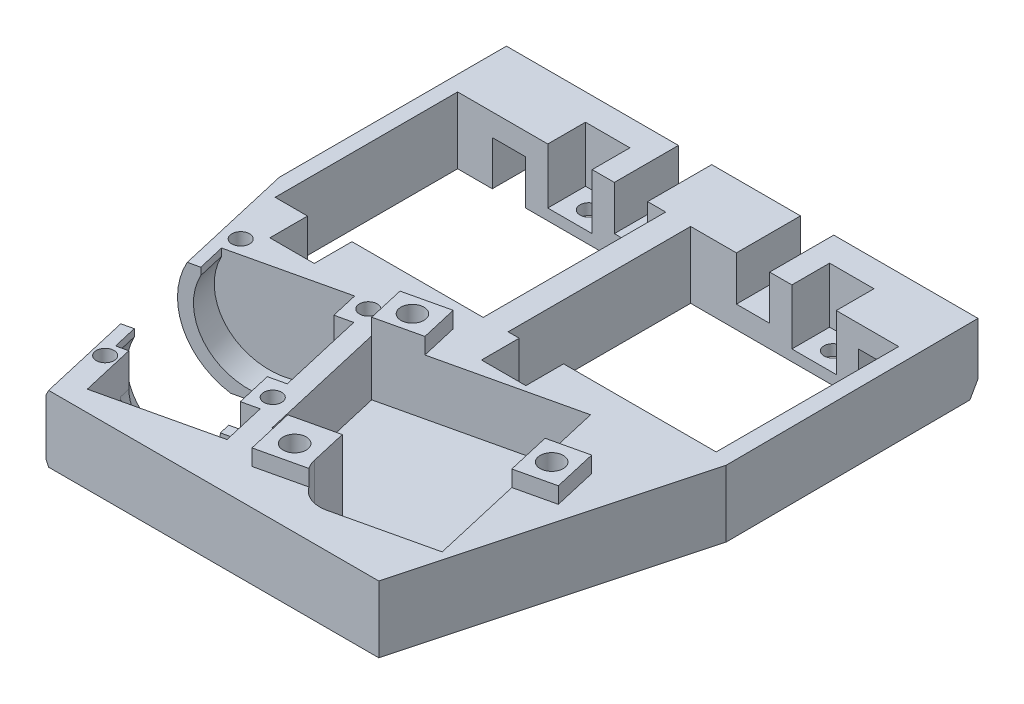
from build123d import *

# Parameters (mm, degrees)
BOSS_EXTRUDE2_DEPTH      = 6
BOSS_EXTRUDE2_DEPTH_BACK = 6
CUT_EXTRUDE1_DEPTH       = 121.097055122
CUT_EXTRUDE1_DEPTH_BACK  = 121.097055122
SKETCH2_W                = 35.5
SKETCH2_H                = 32.9
CUT_EXTRUDE2_START       = 6
SKETCH2_9_W              = 8
SKETCH2_9_H              = 6.8
SKETCH2_9_R              = 1.6
CUT_EXTRUDE2_DEPTH       = 10
CUT_EXTRUDE15_DEPTH      = 121.097055122
CUT_EXTRUDE15_DEPTH_BACK = 117.097055122
CUT_EXTRUDE15_START      = -4
SKETCH2_11_W             = 8
SKETCH2_11_H             = 6.8
SKETCH2_11_R             = 1.6
EXTRUDE_THIN1_START      = -6
EXTRUDE_THIN1_DEPTH      = 4.7
BOSS_EXTRUDE7_START      = -10.7
SKETCH2_15_W             = 8
SKETCH2_15_H             = 6.8
BOSS_EXTRUDE7_DEPTH      = 2
CUT_EXTRUDE3_DEPTH       = 121.423389128
CUT_EXTRUDE3_DEPTH_BACK  = 121.423389128
SKETCH2_10_R             = 1.6
CUT_EXTRUDE4_DEPTH       = 121.423389128
CUT_EXTRUDE4_DEPTH_BACK  = 121.423389128
SKETCH4_W                = 37.5
SKETCH4_H                = 32.9
CUT_EXTRUDE5_START       = -6
SKETCH5_W                = 6
SKETCH5_H                = 11.55
CUT_EXTRUDE5_DEPTH       = 8
CUT_EXTRUDE6_START       = 6
SKETCH5_4_W              = 6
SKETCH5_4_H              = 11.55
CUT_EXTRUDE6_DEPTH       = 8
CUT_EXTRUDE7_DEPTH       = 121.423389128
CUT_EXTRUDE7_DEPTH_BACK  = 121.423389128
BOSS_EXTRUDE3_START      = 8
BOSS_EXTRUDE3_DEPTH      = 5
BOSS_EXTRUDE4_START      = -13
BOSS_EXTRUDE4_DEPTH      = 5
CUT_EXTRUDE9_START       = 8
SKETCH12_4_R             = 13
CUT_EXTRUDE9_DEPTH       = 5
CUT_EXTRUDE10_START      = -12.5
SKETCH12_5_R             = 13
CUT_EXTRUDE10_DEPTH      = 4.5
BOSS_EXTRUDE5_START      = 8
BOSS_EXTRUDE5_DEPTH      = 5
BOSS_EXTRUDE6_START      = -12.5
BOSS_EXTRUDE6_DEPTH      = 4.5
BOSS_EXTRUDE9_START      = 13
BOSS_EXTRUDE9_DEPTH      = 3
BOSS_EXTRUDE10_START     = -17.5
BOSS_EXTRUDE10_DEPTH     = 5
CUT_EXTRUDE20_DEPTH      = 89.442017134
CUT_EXTRUDE20_DEPTH_BACK = 89.442017134
CUT_EXTRUDE11_START      = -4
CUT_EXTRUDE11_DEPTH      = 10
BOSS_EXTRUDE8_START      = 6
SKETCH14_5_W             = 6.8
SKETCH14_5_H             = 8
SKETCH14_5_W_2           = 8.6
SKETCH14_5_H_2           = 8.2
SKETCH14_5_W_3           = 8
SKETCH14_5_H_3           = 7
BOSS_EXTRUDE8_DEPTH      = 2.9
CUT_EXTRUDE13_DEPTH      = 121.54585289
CUT_EXTRUDE13_DEPTH_BACK = 121.54585289
SKETCH14_4_R             = 2.075
FILLET1_R                = 5
CUT_EXTRUDE16_START      = -22.5
SKETCH17_R               = 7.5
SKETCH17_R_2             = 5.5
CUT_EXTRUDE16_DEPTH      = 10
CUT_EXTRUDE17_DEPTH      = 6
CUT_EXTRUDE18_DEPTH      = 121.54585289
CUT_EXTRUDE19_START      = 1.452584
SKETCH18_4_W             = 25.5
SKETCH18_4_H             = 20
CUT_EXTRUDE19_DEPTH      = 4.547416
CUT_EXTRUDE21_START      = 6
SKETCH21_R               = 1.6
CUT_EXTRUDE21_DEPTH      = 10
CUT_EXTRUDE22_DEPTH      = 121.54585289
CUT_EXTRUDE22_DEPTH_BACK = 121.54585289


# Read off the part's stored shape, not the designer's step: Boss-Extrude3, Boss-Extrude4, Boss-Extrude10, Cut-Extrude17
with BuildPart() as part:
    # Sketch1 → Boss-Extrude2 (new, two sides: drawn at the far end of the back side and taken through both)
    with BuildSketch(Plane(origin=(0, 0, 0), x_dir=(1, 0, 0), z_dir=(0, 1, 0)).offset(-BOSS_EXTRUDE2_DEPTH_BACK)):
        Polygon((-12, 0), (73, 0), (73.227745076, -45.633383306), (60, -95), (0, -95), (-12, -43.022289509), align=None)
    extrude(amount=BOSS_EXTRUDE2_DEPTH + BOSS_EXTRUDE2_DEPTH_BACK)

    # Sketch2 → Cut-Extrude1 (cut, two sides: drawn at the far end of the back side and taken through both)
    with BuildSketch(Plane(origin=(0, 0, 0), x_dir=(1, 0, 0), z_dir=(0, 1, 0)).offset(-CUT_EXTRUDE1_DEPTH_BACK)):
        with Locations((8.5, -28)):
            Rectangle(SKETCH2_W, SKETCH2_H)
        with Locations((52.5, -28)):
            Rectangle(SKETCH2_W, SKETCH2_H)
    extrude(amount=CUT_EXTRUDE1_DEPTH + CUT_EXTRUDE1_DEPTH_BACK, mode=Mode.SUBTRACT)

    # Sketch2<9> → Cut-Extrude2 (cut)
    with BuildSketch(Plane(origin=(0, 0, 0), x_dir=(1, 0, 0), z_dir=(0, 1, 0)).offset(CUT_EXTRUDE2_START)):
        with Locations((11, -8.15)):
            Rectangle(SKETCH2_9_W, SKETCH2_9_H)
        with Locations((0.6, -47.85)):
            Rectangle(SKETCH2_9_W, SKETCH2_9_H)
        with Locations((55, -8.15)):
            Rectangle(SKETCH2_9_W, SKETCH2_9_H)
        with Locations(Location((38.75, -47.85, 0), (0, 0, 90))):
            Circle(SKETCH2_9_R)
    extrude(amount=-CUT_EXTRUDE2_DEPTH, mode=Mode.SUBTRACT)

    # Sketch2<11> → Cut-Extrude15 (cut, two sides: drawn at the far end of the back side and taken through both)
    # profile 1 of 2: a face of its own
    with BuildSketch(Plane(origin=(0, 0, 0), x_dir=(1, 0, 0), z_dir=(0, 1, 0)).offset(CUT_EXTRUDE15_START - CUT_EXTRUDE15_DEPTH_BACK)):
        with Locations((38.75, -47.85)):
            Rectangle(SKETCH2_11_W, SKETCH2_11_H)
        with Locations((38.75, -47.85)):
            Circle(SKETCH2_11_R, mode=Mode.SUBTRACT)
    # profile 2 of 2: a face of its own
    with BuildSketch(Plane(origin=(0, 0, 0), x_dir=(1, 0, 0), z_dir=(0, 1, 0)).offset(CUT_EXTRUDE15_START - CUT_EXTRUDE15_DEPTH_BACK)):
        with Locations((38.75, -47.85)):
            Circle(SKETCH2_11_R)
    extrude(amount=CUT_EXTRUDE15_DEPTH + CUT_EXTRUDE15_DEPTH_BACK, mode=Mode.SUBTRACT)

    # Sketch16 → Extrude-Thin1 (add)
    with BuildSketch(Plane(origin=(0, 0, 0), x_dir=(1, 0, 0), z_dir=(0, 1, 0)).offset(EXTRUDE_THIN1_START)):
        Polygon((34.75, -44.45), (34.75, -51.25), (42.75, -51.25), (42.75, -44.45), (44.75, -44.45), (44.75, -53.25), (32.75, -53.25), (32.75, -44.45), align=None)
    extrude(amount=-EXTRUDE_THIN1_DEPTH)

    # Sketch2<15> → Boss-Extrude7 (add)
    with BuildSketch(Plane(origin=(0, 0, 0), x_dir=(1, 0, 0), z_dir=(0, 1, 0)).offset(BOSS_EXTRUDE7_START)):
        with Locations((38.75, -47.85)):
            Rectangle(SKETCH2_15_W, SKETCH2_15_H)
    extrude(amount=BOSS_EXTRUDE7_DEPTH)

    # Sketch2<10> → Cut-Extrude3 (cut, two sides: drawn at the far end of the back side and taken through both)
    with BuildSketch(Plane(origin=(0, 0, 0), x_dir=(1, 0, 0), z_dir=(0, 1, 0)).offset(-CUT_EXTRUDE3_DEPTH_BACK)):
        with Locations(Location((0.6, -47.85, 0), (0, 0, 270))):
            Circle(SKETCH2_10_R)
        with Locations(Location((38.75, -47.85, 0), (0, 0, 270))):
            Circle(SKETCH2_10_R)
        with Locations(Location((55, -8.15, 0), (0, 0, 90))):
            Circle(SKETCH2_10_R)
        with Locations(Location((11, -8.15, 0), (0, 0, 90))):
            Circle(SKETCH2_10_R)
    extrude(amount=CUT_EXTRUDE3_DEPTH + CUT_EXTRUDE3_DEPTH_BACK, mode=Mode.SUBTRACT)

    # Sketch4 → Cut-Extrude4 (cut, two sides: drawn at the far end of the back side and taken through both)
    with BuildSketch(Plane(origin=(0, 0, 0), x_dir=(1, 0, 0), z_dir=(0, 1, 0)).offset(-CUT_EXTRUDE4_DEPTH_BACK)):
        with Locations((9.5, -28)):
            Rectangle(SKETCH4_W, SKETCH4_H)
        with Locations((51.5, -28)):
            Rectangle(SKETCH4_W, SKETCH4_H)
    extrude(amount=CUT_EXTRUDE4_DEPTH + CUT_EXTRUDE4_DEPTH_BACK, mode=Mode.SUBTRACT)

    # Sketch5 → Cut-Extrude5 (cut)
    with BuildSketch(Plane(origin=(0, 0, 0), x_dir=(1, 0, 0), z_dir=(0, 1, 0)).offset(CUT_EXTRUDE5_START)):
        with Locations((0, -5.775)):
            Rectangle(SKETCH5_W, SKETCH5_H)
        with Locations((66, -5.775)):
            Rectangle(SKETCH5_W, SKETCH5_H)
    extrude(amount=CUT_EXTRUDE5_DEPTH, mode=Mode.SUBTRACT)

    # Sketch5<4> → Cut-Extrude6 (cut)
    with BuildSketch(Plane(origin=(0, 0, 0), x_dir=(1, 0, 0), z_dir=(0, 1, 0)).offset(CUT_EXTRUDE6_START)):
        with Locations((22, -5.775)):
            Rectangle(SKETCH5_4_W, SKETCH5_4_H)
        with Locations((44, -5.775)):
            Rectangle(SKETCH5_4_W, SKETCH5_4_H)
    extrude(amount=-CUT_EXTRUDE6_DEPTH, mode=Mode.SUBTRACT)

    # Sketch11 → Cut-Extrude7 (cut, two sides: drawn at the far end of the back side and taken through both)
    with BuildSketch(Plane(origin=(0, 0, 0), x_dir=(0.2249510543438689, 0, 0.9743700647852344), z_dir=(0, 1, 0)).offset(-CUT_EXTRUDE7_DEPTH_BACK)):
        Polygon((59.335574448, -9.370350163), (59.335574448, 4.129649837), (75.335574448, 4.129649837), (75.335574448, -9.370350163), (75.335574448, -28.058089367), (59.335574448, -28.058089367), align=None)
    extrude(amount=CUT_EXTRUDE7_DEPTH + CUT_EXTRUDE7_DEPTH_BACK, mode=Mode.SUBTRACT)

    # Boss-Extrude3 outline → Boss-Extrude3 (add)
    with BuildSketch(Plane(origin=(15.147208467, 0, 65.609768037), x_dir=(0.9743700647852345, 0, -0.2249510543438689), z_dir=(-0.2249510543438689, 0, -0.9743700647852345)).offset(BOSS_EXTRUDE3_START)):
        with BuildLine():
            Line((-20.902912757, 6), (-18.108771073, 6))
            ThreePointArc((-18.108771073, 6), (-9.370350163, 10.6), (-0.631929253, 6))
            Line((-0.631929253, 6), (2.162212432, 6))
            ThreePointArc((2.162212432, 6), (-0.576522413, 9.574371703), (-4.370350163, 12))
            Line((-4.370350163, 12), (-14.370350163, 12))
            ThreePointArc((-14.370350163, 12), (-18.164177912, 9.574371703), (-20.902912757, 6))
        make_face()
    extrude(amount=BOSS_EXTRUDE3_DEPTH)

    # Boss-Extrude4 outline → Boss-Extrude4 (add)
    with BuildSketch(Plane(origin=(15.147208467, 0, 65.609768037), x_dir=(0.9743700647852345, 0, -0.2249510543438689), z_dir=(-0.2249510543438689, 0, -0.9743700647852345)).offset(BOSS_EXTRUDE4_START)):
        with BuildLine():
            ThreePointArc((-18.108771073, 6), (-9.370350163, 10.6), (-0.631929253, 6))
            Line((-0.631929253, 6), (2.162212432, 6))
            ThreePointArc((2.162212432, 6), (-0.576522413, 9.574371703), (-4.370350163, 12))
            Line((-4.370350163, 12), (-14.370350163, 12))
            ThreePointArc((-14.370350163, 12), (-18.164177912, 9.574371703), (-20.902912757, 6))
            Line((-20.902912757, 6), (-18.108771073, 6))
        make_face()
    extrude(amount=BOSS_EXTRUDE4_DEPTH)

    # Sketch12<4> → Cut-Extrude9 (cut)
    with BuildSketch(Plane(origin=(15.147208467, 0, 65.609768037), x_dir=(0.9743700647852345, 0, -0.2249510543438689), z_dir=(-0.2249510543438689, 0, -0.9743700647852345)).offset(CUT_EXTRUDE9_START)):
        with Locations((-9.370350163, 0)):
            Circle(SKETCH12_4_R)
    extrude(amount=CUT_EXTRUDE9_DEPTH, mode=Mode.SUBTRACT)

    # Sketch12<5> → Cut-Extrude10 (cut)
    with BuildSketch(Plane(origin=(15.147208467, 0, 65.609768037), x_dir=(0.9743700647852345, 0, -0.2249510543438689), z_dir=(-0.2249510543438689, 0, -0.9743700647852345)).offset(CUT_EXTRUDE10_START)):
        with Locations((-9.370350163, 0)):
            Circle(SKETCH12_5_R)
    extrude(amount=CUT_EXTRUDE10_DEPTH, mode=Mode.SUBTRACT)

    # Sketch12<7> → Boss-Extrude5 (add)
    with BuildSketch(Plane(origin=(15.147208467, 0, 65.609768037), x_dir=(0.9743700647852345, 0, -0.2249510543438689), z_dir=(-0.2249510543438689, 0, -0.9743700647852345)).offset(BOSS_EXTRUDE5_START)):
        with BuildLine():
            Line((-21.370350163, 5), (-21.370350163, 3.163053095))
            Line((-21.370350163, 3.163053095), (-21.370350163, -4.002520569))
            Line((-21.370350163, -4.002520569), (-21.370350163, -5))
            ThreePointArc((-21.370350163, -5), (-21.147250246, -5.504963618), (-20.902912757, -6))
            Line((-20.902912757, -6), (-18.108771073, -6))
            ThreePointArc((-18.108771073, -6), (-19.970350163, 0), (-18.108771073, 6))
            ThreePointArc((-18.108771073, 6), (-9.370350163, 10.6), (-0.631929253, 6))
            ThreePointArc((-0.631929253, 6), (0.753563647, 3.141077709), (1.229649837, 0))
            ThreePointArc((1.229649837, 0), (0.753563647, -3.141077709), (-0.631929253, -6))
            Line((-0.631929253, -6), (2.162212432, -6))
            ThreePointArc((2.162212432, -6), (3.257462667, -3.088420816), (3.629649837, 0))
            ThreePointArc((3.629649837, 0), (1.446303664, 7.211102551), (-4.370350163, 12))
            Line((-4.370350163, 12), (-14.370350163, 12))
            ThreePointArc((-14.370350163, 12), (-18.562738318, 9.192388155), (-21.370350163, 5))
        make_face()
        with BuildLine():
            Line((-21.370350163, -4.002520569), (-21.370350163, 3.163053095))
            Line((-21.370350163, 3.163053095), (-21.370350163, 5))
            ThreePointArc((-21.370350163, 5), (-22.370350163, 0), (-21.370350163, -5))
            Line((-21.370350163, -5), (-21.370350163, -4.002520569))
        make_face()
    extrude(amount=BOSS_EXTRUDE5_DEPTH)

    # Sketch12<9> → Boss-Extrude6 (add)
    with BuildSketch(Plane(origin=(15.147208467, 0, 65.609768037), x_dir=(0.9743700647852345, 0, -0.2249510543438689), z_dir=(-0.2249510543438689, 0, -0.9743700647852345)).offset(BOSS_EXTRUDE6_START)):
        with BuildLine():
            ThreePointArc((-14.370350163, 12), (-21.590473177, 4.434928806), (-20.902912757, -6))
            Line((-20.902912757, -6), (-18.108771073, -6))
            ThreePointArc((-18.108771073, -6), (-9.370350163, 10.6), (-0.631929253, -6))
            Line((-0.631929253, -6), (2.162212432, -6))
            ThreePointArc((2.162212432, -6), (2.849772852, 4.434928806), (-4.370350163, 12))
            Line((-4.370350163, 12), (-14.370350163, 12))
        make_face()
    extrude(amount=BOSS_EXTRUDE6_DEPTH)

    # Sketch12<10> → Boss-Extrude9 (add)
    with BuildSketch(Plane(origin=(15.147208467, 0, 65.609768037), x_dir=(0.9743700647852345, 0, -0.2249510543438689), z_dir=(-0.2249510543438689, 0, -0.9743700647852345)).offset(BOSS_EXTRUDE9_START)):
        with BuildLine():
            Line((-21.370350163, 5), (-21.370350163, 3.163053095))
            Line((-21.370350163, 3.163053095), (-21.370350163, -4.002520569))
            Line((-21.370350163, -4.002520569), (-21.370350163, -5))
            ThreePointArc((-21.370350163, -5), (-21.147250246, -5.504963618), (-20.902912757, -6))
            Line((-20.902912757, -6), (-18.108771073, -6))
            ThreePointArc((-18.108771073, -6), (-19.970350163, 0), (-18.108771073, 6))
            ThreePointArc((-18.108771073, 6), (-9.370350163, 10.6), (-0.631929253, 6))
            ThreePointArc((-0.631929253, 6), (0.753563647, 3.141077709), (1.229649837, 0))
            ThreePointArc((1.229649837, 0), (0.753563647, -3.141077709), (-0.631929253, -6))
            Line((-0.631929253, -6), (2.162212432, -6))
            ThreePointArc((2.162212432, -6), (3.257462667, -3.088420816), (3.629649837, 0))
            ThreePointArc((3.629649837, 0), (1.446303664, 7.211102551), (-4.370350163, 12))
            Line((-4.370350163, 12), (-14.370350163, 12))
            ThreePointArc((-14.370350163, 12), (-18.562738318, 9.192388155), (-21.370350163, 5))
        make_face()
        with BuildLine():
            ThreePointArc((-0.631929253, 6), (-9.370350163, 10.6), (-18.108771073, 6))
            Line((-18.108771073, 6), (-0.631929253, 6))
        make_face()
    extrude(amount=BOSS_EXTRUDE9_DEPTH)

    # Boss-Extrude10 outline → Boss-Extrude10 (add)
    with BuildSketch(Plane(origin=(15.147208467, 0, 65.609768037), x_dir=(0.9743700647852345, 0, -0.2249510543438689), z_dir=(-0.2249510543438689, 0, -0.9743700647852345)).offset(BOSS_EXTRUDE10_START)):
        with BuildLine():
            Line((-4.370350163, 12), (-14.370350163, 12))
            ThreePointArc((-14.370350163, 12), (-18.164177912, 9.574371703), (-20.902912757, 6))
            Line((-20.902912757, 6), (2.162212432, 6))
            ThreePointArc((2.162212432, 6), (-0.576522413, 9.574371703), (-4.370350163, 12))
        make_face()
    extrude(amount=BOSS_EXTRUDE10_DEPTH)

    # Sketch20 → Cut-Extrude20 (cut, two sides: drawn at the far end of the back side and taken through both)
    with BuildSketch(Plane(origin=(15.147208467, 0, 65.609768037), x_dir=(0.9743700647852345, 0, -0.2249510543438689), z_dir=(-0.2249510543438689, 0, -0.9743700647852345)).offset(-CUT_EXTRUDE20_DEPTH_BACK)):
        with BuildLine():
            ThreePointArc((-20.902912757, -6), (-22.370350163, 0), (-20.902912757, 6))
            Line((-20.902912757, 6), (-20.902912757, 13.688121188))
            Line((-20.902912757, 13.688121188), (-35.899233089, 13.688121188))
            Line((-35.899233089, 13.688121188), (-35.899233089, -13.876807322))
            Line((-35.899233089, -13.876807322), (-20.902912757, -13.876807322))
            Line((-20.902912757, -13.876807322), (-20.902912757, -6))
        make_face()
    extrude(amount=CUT_EXTRUDE20_DEPTH + CUT_EXTRUDE20_DEPTH_BACK, mode=Mode.SUBTRACT)

    # Sketch14 → Cut-Extrude11 (cut)
    with BuildSketch(Plane(origin=(0, 0, 0), x_dir=(0.2249510543438689, 0, 0.9743700647852344), z_dir=(0, 1, 0)).offset(CUT_EXTRUDE11_START)):
        Polygon((60.635574448, 7.629649837), (84.585574448, 7.629649837), (84.585574448, 18.179649837), (96.335574448, 18.179649837), (96.335574448, 40.529649837), (60.635574448, 40.529649837), align=None)
    extrude(amount=CUT_EXTRUDE11_DEPTH, mode=Mode.SUBTRACT)

    # Sketch14<5> → Boss-Extrude8 (add)
    with BuildSketch(Plane(origin=(0, 0, 0), x_dir=(0.2249510543438689, 0, 0.9743700647852344), z_dir=(0, 1, 0)).offset(BOSS_EXTRUDE8_START)):
        with Locations((57.235574448, 11.629649837)):
            Rectangle(SKETCH14_5_W, SKETCH14_5_H)
        with Locations((88.885574448, 14.079649837)):
            Rectangle(SKETCH14_5_W_2, SKETCH14_5_H_2)
        with Locations((75.585574448, 44.029649837)):
            Rectangle(SKETCH14_5_W_3, SKETCH14_5_H_3)
    extrude(amount=BOSS_EXTRUDE8_DEPTH)

    # Sketch14<4> → Cut-Extrude13 (cut, two sides: drawn at the far end of the back side and taken through both)
    with BuildSketch(Plane(origin=(0, 0, 0), x_dir=(0.2249510543438689, 0, 0.9743700647852344), z_dir=(0, 1, 0)).offset(-CUT_EXTRUDE13_DEPTH_BACK)):
        with Locations(Location((75.585574448, 44.029649837, 0), (0, 0, 347))):
            Circle(SKETCH14_4_R)
        with Locations(Location((89.485574448, 14.079649837, 0), (0, 0, 347))):
            Circle(SKETCH14_4_R)
        with Locations(Location((57.235574448, 11.629649837, 0), (0, 0, 347))):
            Circle(SKETCH14_4_R)
    extrude(amount=CUT_EXTRUDE13_DEPTH + CUT_EXTRUDE13_DEPTH_BACK, mode=Mode.SUBTRACT)

    # Fillet1
    # the kernel refuses this fillet: 5 mm, written as the material it adds along each edge
    with BuildSketch(Plane(origin=(39.384495633, -4, 89.776968518), x_dir=(0.9743700647852339, 0, -0.22495105434387005), z_dir=(0, 1, 0))) as fillet1_piece_1_section:
        with BuildLine():
            CenterArc((FILLET1_R, FILLET1_R), FILLET1_R, 180, 90)
            Line((0, FILLET1_R), (0, 0))
            Line((0, 0), (FILLET1_R, 0))
        make_face()
    fillet1_piece_1 = extrude(amount=10, mode=Mode.PRIVATE)
    fillet1_piece_1 = split(fillet1_piece_1, bisect_by=Plane(origin=(39.850611244, 1, 86.43649931), z_dir=(0.2249510543438689, 0, 0.9743700647852344)), keep=Keep.TOP, mode=Mode.PRIVATE)
    add(fillet1_piece_1)
    with BuildSketch(Plane(origin=(39.384495633, -4, 89.776968518), x_dir=(0.9743700647852339, 0, -0.22495105434387005), z_dir=(0, 1, 0))) as fillet1_piece_2_section:
        with BuildLine():
            CenterArc((FILLET1_R, FILLET1_R), FILLET1_R, 180, 90)
            Line((0, FILLET1_R), (0, 0))
            Line((0, 0), (FILLET1_R, 0))
        make_face()
    fillet1_piece_2 = extrude(amount=10, mode=Mode.PRIVATE)
    fillet1_piece_2 = split(fillet1_piece_2, bisect_by=Plane(origin=(38.708870638, 1, 86.700090898), z_dir=(-0.2249510543438689, 0, -0.9743700647852344)), keep=Keep.TOP, mode=Mode.PRIVATE)
    add(fillet1_piece_2)
    with BuildSketch(Plane(origin=(39.384495633, -4, 89.776968518), x_dir=(0.9743700647852339, 0, -0.22495105434387005), z_dir=(0, 1, 0))) as fillet1_piece_3_section:
        with BuildLine():
            CenterArc((FILLET1_R, FILLET1_R), FILLET1_R, 180, 90)
            Line((0, FILLET1_R), (0, 0))
            Line((0, 0), (FILLET1_R, 0))
        make_face()
    fillet1_piece_3 = extrude(amount=22.5, mode=Mode.PRIVATE)
    fillet1_piece_3 = split(fillet1_piece_3, bisect_by=Plane(origin=(38.557191357, 6, 86.043095751), z_dir=(0, 1, 0)), keep=Keep.TOP, mode=Mode.PRIVATE)
    fillet1_piece_3 = split(fillet1_piece_3, bisect_by=Plane(origin=(38.708870638, 7.45, 86.700090898), z_dir=(-0.2249510543438689, 0, -0.9743700647852344)), keep=Keep.TOP, mode=Mode.PRIVATE)
    fillet1_piece_3 = split(fillet1_piece_3, bisect_by=Plane(origin=(38.557191357, 8.9, 86.043095751), z_dir=(0, -1, 0)), keep=Keep.TOP, mode=Mode.PRIVATE)
    add(fillet1_piece_3)

    # Sketch17 → Cut-Extrude16 (cut)
    # profile 1 of 2: a face of its own
    with BuildSketch(Plane(origin=(15.147208467, 0, 65.609768037), x_dir=(0.9743700647852345, 0, -0.2249510543438689), z_dir=(-0.2249510543438689, 0, -0.9743700647852345)).offset(CUT_EXTRUDE16_START)):
        with Locations((-9.370350163, 0)):
            Circle(SKETCH17_R)
        with Locations((-9.370350163, 0)):
            Circle(SKETCH17_R_2, mode=Mode.SUBTRACT)
    # profile 2 of 2: a face of its own
    with BuildSketch(Plane(origin=(15.147208467, 0, 65.609768037), x_dir=(0.9743700647852345, 0, -0.2249510543438689), z_dir=(-0.2249510543438689, 0, -0.9743700647852345)).offset(CUT_EXTRUDE16_START)):
        with Locations((-9.370350163, 0)):
            Circle(SKETCH17_R_2)
    extrude(amount=CUT_EXTRUDE16_DEPTH, mode=Mode.SUBTRACT)

    # Cut-Extrude17 outline → Cut-Extrude17 (cut)
    with BuildSketch(Plane(origin=(0, 0, 0), x_dir=(0.2249510543438689, 0, 0.9743700647852344), z_dir=(0, 1, 0))):
        Polygon((89.835574448, 4.129649837), (81.835574448, 4.129649837), (81.835574448, 1.129649837), (79.835574448, 1.129649837), (79.835574448, -16.870350163), (89.835574448, -16.870350163), align=None)
    extrude(amount=CUT_EXTRUDE17_DEPTH, mode=Mode.SUBTRACT)

    # Sketch18<3> → Cut-Extrude18 (cut, through all)
    with BuildSketch(Plane(origin=(0, 0, 0), x_dir=(0.2249510543438689, 0, 0.9743700647852344), z_dir=(0, 1, 0))):
        Polygon((81.835574448, 1.129649837), (81.835574448, -16.870350163), (89.835574448, -16.870350163), (89.835574448, 4.129649837), (81.835574448, 4.129649837), align=None)
    extrude(amount=-CUT_EXTRUDE18_DEPTH, mode=Mode.SUBTRACT)

    # Sketch18<4> → Cut-Extrude19 (cut)
    with BuildSketch(Plane(origin=(0, 0, 0), x_dir=(0.2249510543438689, 0, 0.9743700647852344), z_dir=(0, 1, 0)).offset(CUT_EXTRUDE19_START)):
        with Locations((67.085574448, -8.870350163)):
            Rectangle(SKETCH18_4_W, SKETCH18_4_H)
    extrude(amount=CUT_EXTRUDE19_DEPTH, mode=Mode.SUBTRACT)

    # Sketch21 → Cut-Extrude21 (cut)
    with BuildSketch(Plane(origin=(0, 0, 0), x_dir=(0.2249510543438689, 0, 0.9743700647852344), z_dir=(0, 1, 0)).offset(CUT_EXTRUDE21_START)):
        with Locations(Location((51.335574448, -17.870350163, 0), (0, 0, 167))):
            Circle(SKETCH21_R)
        with Locations(Location((55.835574448, 4.129649837, 0), (0, 0, 167))):
            Circle(SKETCH21_R)
        with Locations(Location((78.835574448, 4.129649837, 0), (0, 0, 167))):
            Circle(SKETCH21_R)
        with Locations(Location((82.335574448, -18.870350163, 0), (0, 0, 167))):
            Circle(SKETCH21_R)
    extrude(amount=-CUT_EXTRUDE21_DEPTH, mode=Mode.SUBTRACT)

    # Sketch22 → Cut-Extrude22 (cut, two sides: drawn at the far end of the back side and taken through both)
    with BuildSketch(Plane(origin=(0, 0, 0), x_dir=(0, 0, -1), z_dir=(1, 0, 0)).offset(-CUT_EXTRUDE22_DEPTH_BACK)):
        with BuildLine():
            ThreePointArc((8, -6), (3.757359313, -4.242640687), (2, 0))
            Line((2, 0), (-5.52362234, -13.031296149))
            Line((-5.52362234, -13.031296149), (8, -13.031296149))
            Line((8, -13.031296149), (8, -6))
        make_face()
    extrude(amount=CUT_EXTRUDE22_DEPTH + CUT_EXTRUDE22_DEPTH_BACK, mode=Mode.SUBTRACT)


solid = part.part
